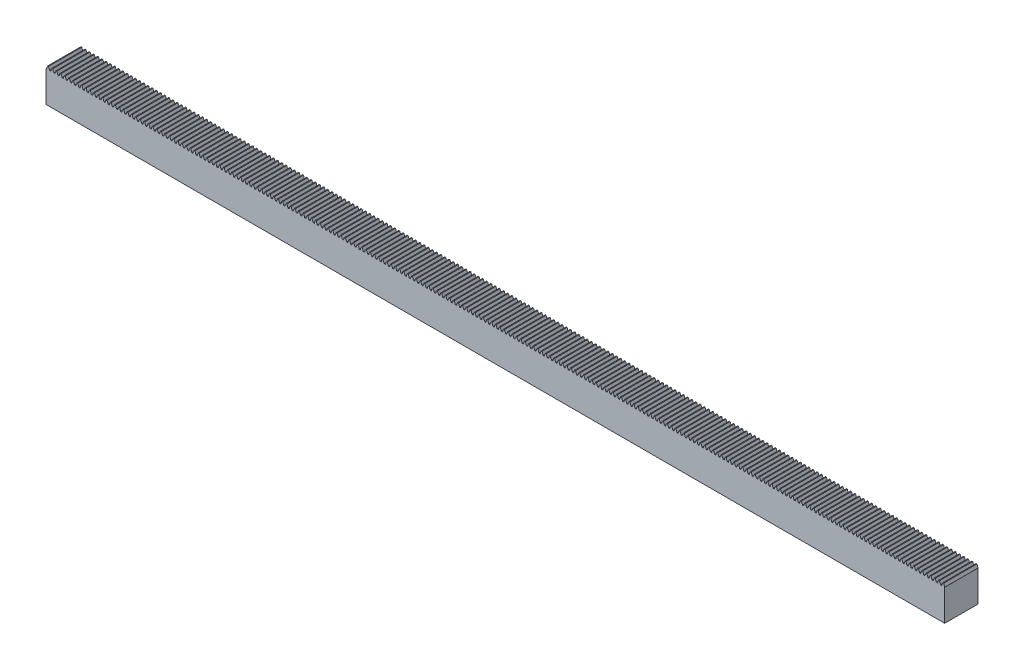
from build123d import *

# Parameters (mm, degrees)
BLANKSKE_W        = 1350
BLANKSKE_H        = 51.4
BLANK_DEPTH       = 50
TOOTHCUTSIM_DEPTH = 1352.903088243
TEETHCUTS_COUNT   = 216
TEETHCUTS_PITCH   = 6.2831853


with BuildPart() as part:
    # BlankSke → Blank (new body)
    with BuildSketch(Plane.XY):
        with Locations((675, 25.7)):
            Rectangle(BLANKSKE_W, BLANKSKE_H)
    extrude(amount=-BLANK_DEPTH)

    # TooCutSkeSim → ToothCutSim (cut, through all)
    with BuildSketch(Plane.XY):
        Polygon((0.861870739, 46.9), (-0.861870739, 46.9), (-2.508981637, 51.4254), (2.508981637, 51.4254), align=None)
    toothcutsim = extrude(amount=-TOOTHCUTSIM_DEPTH, mode=Mode.SUBTRACT)

    # TeethCuts: ToothCutSim ×216
    with Locations(*[(i * TEETHCUTS_PITCH, 0, 0) for i in range(1, TEETHCUTS_COUNT)]):
        add(toothcutsim, mode=Mode.SUBTRACT)


solid = part.part
